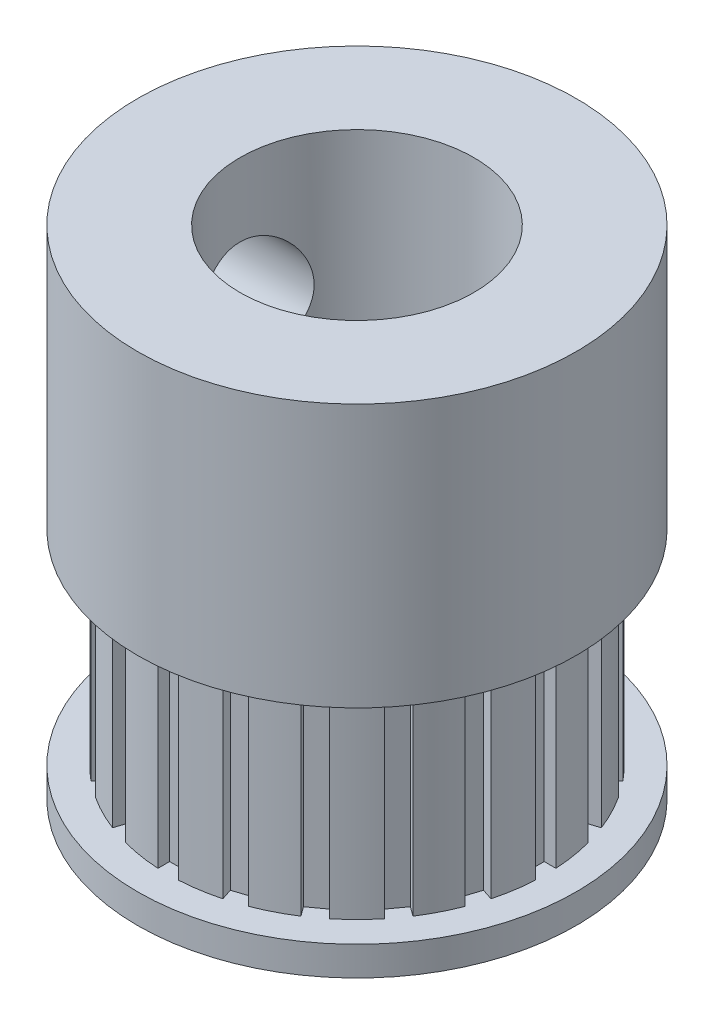
from build123d import *

# Parameters (mm, degrees)
SKETCH_1_R          = 7.5
EXTRUDE_1_DEPTH     = 1
EXTRUDE_2_DEPTH     = 7
SKETCH_3_R          = 7.5
EXTRUDE_3_DEPTH     = 9
CUT_EXTRUDE_1_REACH = 22.037
SKETCH_4_R          = 4
CUT_EXTRUDE_2_REACH = 22.037
SKETCH_5_R          = 2


with BuildPart() as part:
    # 草图1 → 凸台-拉伸1 (new body)
    with BuildSketch(Plane(origin=(0, 0, 0), x_dir=(1, 0, 0), z_dir=(0, 1, 0))):
        Circle(SKETCH_1_R)
    extrude(amount=EXTRUDE_1_DEPTH)

    # 草图2 → 凸台-拉伸2 (add)
    with BuildSketch(Plane(origin=(0, 1, 0), x_dir=(1, 0, 0), z_dir=(0, 1, 0))):
        with BuildLine():
            Line((-0.35, 6.055518957), (-0.35, 6.455518957))
            ThreePointArc((-0.35, 6.455518957), (-1.011348816, 6.385405122), (-1.661995284, 6.247719318))
            Line((-1.661995284, 6.247719318), (-1.538388487, 5.867296711))
            Line((-1.538388487, 5.867296711), (-2.204128048, 5.650984815))
            Line((-2.204128048, 5.650984815), (-2.327734846, 6.031407422))
            ThreePointArc((-2.327734846, 6.031407422), (-2.935048581, 5.760357179), (-3.511302891, 5.428349382))
            Line((-3.511302891, 5.428349382), (-3.27618879, 5.104742584))
            Line((-3.27618879, 5.104742584), (-3.842500686, 4.693292907))
            Line((-3.842500686, 4.693292907), (-4.077614787, 5.016899705))
            ThreePointArc((-4.077614787, 5.016899705), (-4.57144534, 4.57144534), (-5.016899705, 4.077614787))
            Line((-5.016899705, 4.077614787), (-4.693292907, 3.842500686))
            Line((-4.693292907, 3.842500686), (-5.104742584, 3.27618879))
            Line((-5.104742584, 3.27618879), (-5.428349382, 3.511302891))
            ThreePointArc((-5.428349382, 3.511302891), (-5.760357179, 2.935048581), (-6.031407422, 2.327734846))
            Line((-6.031407422, 2.327734846), (-5.650984815, 2.204128048))
            Line((-5.650984815, 2.204128048), (-5.867296711, 1.538388487))
            Line((-5.867296711, 1.538388487), (-6.247719318, 1.661995284))
            ThreePointArc((-6.247719318, 1.661995284), (-6.385405122, 1.011348816), (-6.455518957, 0.35))
            Line((-6.455518957, 0.35), (-6.055518957, 0.35))
            Line((-6.055518957, 0.35), (-6.055518957, -0.35))
            Line((-6.055518957, -0.35), (-6.455518957, -0.35))
            ThreePointArc((-6.455518957, -0.35), (-6.385405122, -1.011348816), (-6.247719318, -1.661995284))
            Line((-6.247719318, -1.661995284), (-5.867296711, -1.538388487))
            Line((-5.867296711, -1.538388487), (-5.650984815, -2.204128048))
            Line((-5.650984815, -2.204128048), (-6.031407422, -2.327734846))
            ThreePointArc((-6.031407422, -2.327734846), (-5.760357179, -2.935048581), (-5.428349382, -3.511302891))
            Line((-5.428349382, -3.511302891), (-5.104742584, -3.27618879))
            Line((-5.104742584, -3.27618879), (-4.693292907, -3.842500686))
            Line((-4.693292907, -3.842500686), (-5.016899705, -4.077614787))
            ThreePointArc((-5.016899705, -4.077614787), (-4.57144534, -4.57144534), (-4.077614787, -5.016899705))
            Line((-4.077614787, -5.016899705), (-3.842500686, -4.693292907))
            Line((-3.842500686, -4.693292907), (-3.27618879, -5.104742584))
            Line((-3.27618879, -5.104742584), (-3.511302891, -5.428349382))
            ThreePointArc((-3.511302891, -5.428349382), (-2.935048581, -5.760357179), (-2.327734846, -6.031407422))
            Line((-2.327734846, -6.031407422), (-2.204128048, -5.650984815))
            Line((-2.204128048, -5.650984815), (-1.538388487, -5.867296711))
            Line((-1.538388487, -5.867296711), (-1.661995284, -6.247719318))
            ThreePointArc((-1.661995284, -6.247719318), (-1.011348816, -6.385405122), (-0.35, -6.455518957))
            Line((-0.35, -6.455518957), (-0.35, -6.055518957))
            Line((-0.35, -6.055518957), (0.35, -6.055518957))
            Line((0.35, -6.055518957), (0.35, -6.455518957))
            ThreePointArc((0.35, -6.455518957), (1.011348816, -6.385405122), (1.661995284, -6.247719318))
            Line((1.661995284, -6.247719318), (1.538388487, -5.867296711))
            Line((1.538388487, -5.867296711), (2.204128048, -5.650984815))
            Line((2.204128048, -5.650984815), (2.327734846, -6.031407422))
            ThreePointArc((2.327734846, -6.031407422), (2.935048581, -5.760357179), (3.511302891, -5.428349382))
            Line((3.511302891, -5.428349382), (3.27618879, -5.104742584))
            Line((3.27618879, -5.104742584), (3.842500686, -4.693292907))
            Line((3.842500686, -4.693292907), (4.077614787, -5.016899705))
            ThreePointArc((4.077614787, -5.016899705), (4.57144534, -4.57144534), (5.016899705, -4.077614787))
            Line((5.016899705, -4.077614787), (4.693292907, -3.842500686))
            Line((4.693292907, -3.842500686), (5.104742584, -3.27618879))
            Line((5.104742584, -3.27618879), (5.428349382, -3.511302891))
            ThreePointArc((5.428349382, -3.511302891), (5.760357179, -2.935048581), (6.031407422, -2.327734846))
            Line((6.031407422, -2.327734846), (5.650984815, -2.204128048))
            Line((5.650984815, -2.204128048), (5.867296711, -1.538388487))
            Line((5.867296711, -1.538388487), (6.247719318, -1.661995284))
            ThreePointArc((6.247719318, -1.661995284), (6.385405122, -1.011348816), (6.455518957, -0.35))
            Line((6.455518957, -0.35), (6.055518957, -0.35))
            Line((6.055518957, -0.35), (6.055518957, 0.35))
            Line((6.055518957, 0.35), (6.455518957, 0.35))
            ThreePointArc((6.455518957, 0.35), (6.385405122, 1.011348816), (6.247719318, 1.661995284))
            Line((6.247719318, 1.661995284), (5.867296711, 1.538388487))
            Line((5.867296711, 1.538388487), (5.650984815, 2.204128048))
            Line((5.650984815, 2.204128048), (6.031407422, 2.327734846))
            ThreePointArc((6.031407422, 2.327734846), (5.760357179, 2.935048581), (5.428349382, 3.511302891))
            Line((5.428349382, 3.511302891), (5.104742584, 3.27618879))
            Line((5.104742584, 3.27618879), (4.693292907, 3.842500686))
            Line((4.693292907, 3.842500686), (5.016899705, 4.077614787))
            ThreePointArc((5.016899705, 4.077614787), (4.57144534, 4.57144534), (4.077614787, 5.016899705))
            Line((4.077614787, 5.016899705), (3.842500686, 4.693292907))
            Line((3.842500686, 4.693292907), (3.27618879, 5.104742584))
            Line((3.27618879, 5.104742584), (3.511302891, 5.428349382))
            ThreePointArc((3.511302891, 5.428349382), (2.935048581, 5.760357179), (2.327734846, 6.031407422))
            Line((2.327734846, 6.031407422), (2.204128048, 5.650984815))
            Line((2.204128048, 5.650984815), (1.538388487, 5.867296711))
            Line((1.538388487, 5.867296711), (1.661995284, 6.247719318))
            ThreePointArc((1.661995284, 6.247719318), (1.011348816, 6.385405122), (0.35, 6.455518957))
            Line((0.35, 6.455518957), (0.35, 6.055518957))
            Line((0.35, 6.055518957), (-0.35, 6.055518957))
        make_face()
    extrude(amount=EXTRUDE_2_DEPTH)

    # 草图3 → 凸台-拉伸3 (add)
    with BuildSketch(Plane(origin=(0, 8, 0), x_dir=(1, 0, 0), z_dir=(0, 1, 0))):
        Circle(SKETCH_3_R)
    extrude(amount=EXTRUDE_3_DEPTH)

    # 草图4 → 切除-拉伸1 (cut, up to next)
    with BuildSketch(Plane(origin=(0, 17, 0), x_dir=(1, 0, 0), z_dir=(0, 1, 0)), mode=Mode.PRIVATE) as cut_extrude_1_sk1:
        Circle(SKETCH_4_R)
    cut_extrude_1_tool1 = extrude(cut_extrude_1_sk1.sketch, amount=-CUT_EXTRUDE_1_REACH, mode=Mode.PRIVATE) & part.part
    add(cut_extrude_1_tool1.solids().sort_by_distance((0, 17, 0))[0], mode=Mode.SUBTRACT)

    # 草图5 → 切除-拉伸2 (cut, up to next)
    with BuildSketch(Plane(origin=(0, 0, 0), x_dir=(0, 0, -1), z_dir=(1, 0, 0)), mode=Mode.PRIVATE) as cut_extrude_2_sk1:
        with Locations((0, 12.5)):
            Circle(SKETCH_5_R)
    cut_extrude_2_tool1 = extrude(cut_extrude_2_sk1.sketch, amount=-CUT_EXTRUDE_2_REACH, mode=Mode.PRIVATE) & part.part
    add(cut_extrude_2_tool1.solids().sort_by_distance((0, 12.5, 0))[0], mode=Mode.SUBTRACT)


solid = part.part
